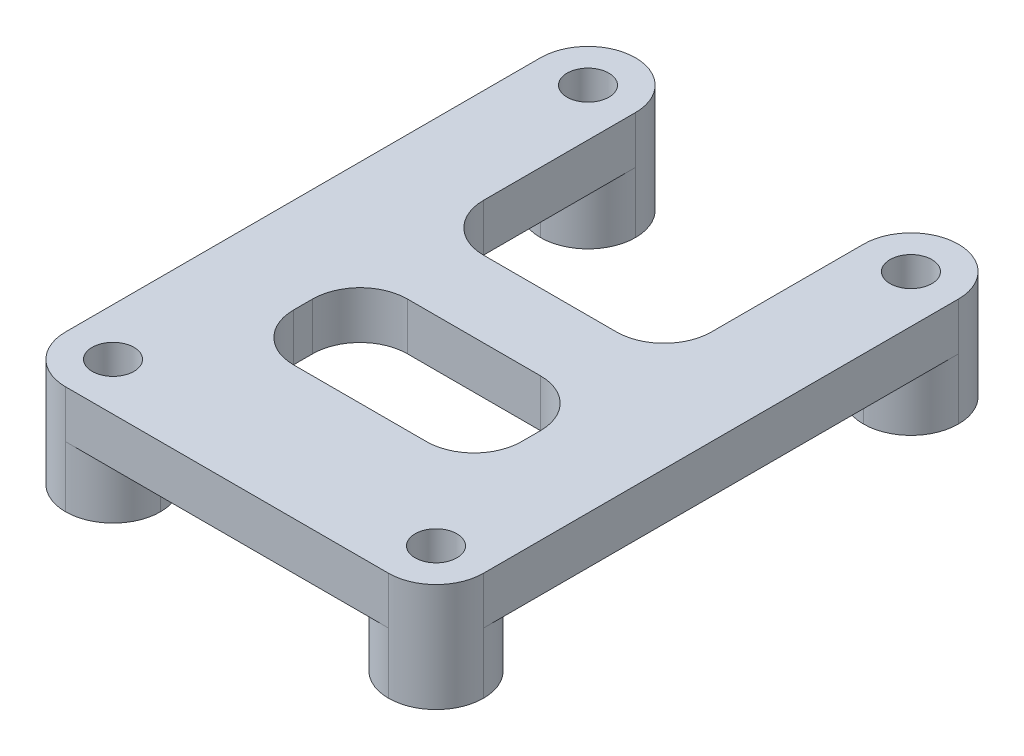
from build123d import *

# Parameters (mm, degrees)
SKETCH1_W           = 12
SKETCH1_H           = 12
SKETCH1_W_2         = 5
SKETCH1_H_2         = 5
BOSS_EXTRUDE1_DEPTH = 2.5
SKETCH2_W           = 5
SKETCH2_H           = 5
BOSS_EXTRUDE2_DEPTH = 3.2
SKETCH3_R           = 1.1
CUT_EXTRUDE1_DEPTH  = 20.454819454
FILLET1_R           = 2.5
CUT_EXTRUDE2_DEPTH  = 20.454819454


with BuildPart() as part:
    # Sketch1 → Boss-Extrude1 (new body)
    with BuildSketch(Plane(origin=(0, 0, 0), x_dir=(1, 0, 0), z_dir=(0, 1, 0))):
        Polygon((-6, -10), (-6, 2), (-6, 10), (-11, 10), (-11, -10), align=None)
        with Locations((0, -4)):
            Rectangle(SKETCH1_W, SKETCH1_H)
        Polygon((6, 10), (6, 2), (6, -10), (11, -10), (11, 10), align=None)
        with Locations((8.5, 12.5)):
            Rectangle(SKETCH1_W_2, SKETCH1_H_2)
        with Locations((-8.5, 12.5)):
            Rectangle(SKETCH1_W_2, SKETCH1_H_2)
        Polygon((11, -10), (11, -15), (-11, -15), (-11, -10), (-6, -10), (6, -10), align=None)
    extrude(amount=BOSS_EXTRUDE1_DEPTH)

    # Sketch2 → Boss-Extrude2 (add)
    with BuildSketch(Plane.XZ):
        with Locations((-8.5, -12.5)):
            Rectangle(SKETCH2_W, SKETCH2_H)
        with Locations((-8.5, 12.5)):
            Rectangle(SKETCH2_W, SKETCH2_H)
        with Locations((8.5, -12.5)):
            Rectangle(SKETCH2_W, SKETCH2_H)
        with Locations((8.5, 12.5)):
            Rectangle(SKETCH2_W, SKETCH2_H)
    extrude(amount=BOSS_EXTRUDE2_DEPTH)

    # Sketch3 → Cut-Extrude1 (cut, through all)
    with BuildSketch(Plane(origin=(0, 2.5, 0), x_dir=(1, 0, 0), z_dir=(0, 1, 0))):
        with Locations(Location((-8.5, 12.5, 0), (0, 0, 270))):
            Circle(SKETCH3_R)
        with Locations(Location((-8.5, -12.5, 0), (0, 0, 90))):
            Circle(SKETCH3_R)
        with Locations(Location((8.5, -12.5, 0), (0, 0, 270))):
            Circle(SKETCH3_R)
        with Locations(Location((8.5, 12.5, 0), (0, 0, 90))):
            Circle(SKETCH3_R)
    extrude(amount=-CUT_EXTRUDE1_DEPTH, mode=Mode.SUBTRACT)

    # Fillet1
    fillet1_edges = [part.edges().sort_by_distance(p)[0] for p in [
        (-11, -1.6, -10),
        (6, -1.6, -10),
        (6, -1.6, 10),
        (11, -1.6, -10),
        (-6, -1.6, -10),
        (-11, -1.6, 10),
        (-6, -1.6, 10),
        (11, -1.6, 10),
        (11, -0.35, 15),
        (-6, -1.6, 15),
        (6, -1.6, 15),
        (-11, -0.35, 15),
        (-11, -0.35, -15),
        (-6, -0.35, -15),
        (11, -0.35, -15),
        (6, -0.35, -15),
        (6, 1.25, -2),
        (-6, 1.25, -2),
    ]]
    fillet(fillet1_edges, radius=FILLET1_R - 0.0001)  # a hair under: the kernel refuses the full size

    # Sketch4 → Cut-Extrude2 (cut, through all)
    with BuildSketch(Plane(origin=(0, 2.5, 0), x_dir=(1, 0, 0), z_dir=(0, 1, 0))):
        with BuildLine():
            Line((-3.5, -2), (3.5, -2))
            ThreePointArc((3.5, -2), (5.267766953, -2.732233047), (6, -4.5))
            Line((6, -4.5), (6, -5.5))
            ThreePointArc((6, -5.5), (5.267766953, -7.267766953), (3.5, -8))
            Line((3.5, -8), (-3.5, -8))
            ThreePointArc((-3.5, -8), (-5.267766953, -7.267766953), (-6, -5.5))
            Line((-6, -5.5), (-6, -4.5))
            ThreePointArc((-6, -4.5), (-5.267766953, -2.732233047), (-3.5, -2))
        make_face()
    extrude(amount=-CUT_EXTRUDE2_DEPTH, mode=Mode.SUBTRACT)


solid = part.part
